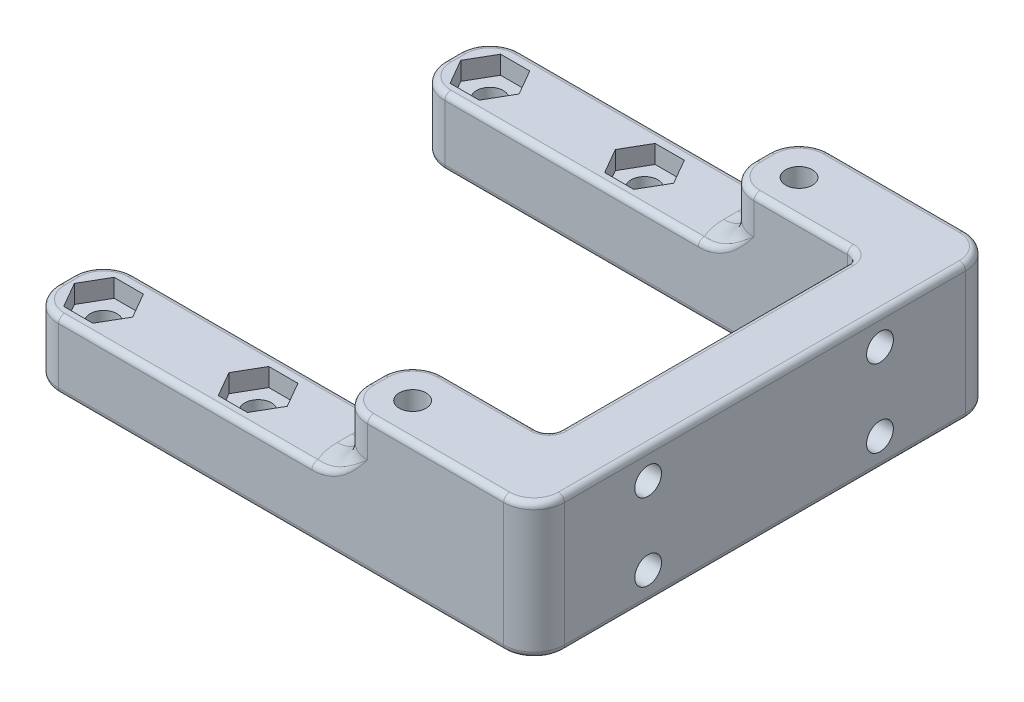
from build123d import *

# Parameters (mm, degrees)
SKETCH1_R           = 2.2
BOSS_EXTRUDE1_DEPTH = 22.2504
SKETCH2_W           = 50.8
SKETCH2_H           = 11.1252
CUT_EXTRUDE1_DEPTH  = 115.756630236
CUT_EXTRUDE2_DEPTH  = 3
FILLET3_R           = 5
CUT_EXTRUDE3_REACH  = 108.964
SKETCH4_R           = 2.2
FILLET4_R           = 5
FILLET5_R           = 5
FILLET6_R           = 2
FILLET7_R           = 1


with BuildPart() as part:
    # Sketch1 → Boss-Extrude1 (new body)
    with BuildSketch(Plane(origin=(0, 0, 0), x_dir=(1, 0, 0), z_dir=(0, 1, 0))):
        Polygon((0, 0), (73.15, 0), (73.15, -51.1048), (0, -51.1048), (0, -63.5), (83.15, -63.5), (83.15, 12.3952), (0, 12.3952), align=None)
        with Locations(Location((6.35, 6.0452, 0), (0, 0, 90))):
            Circle(SKETCH1_R, mode=Mode.SUBTRACT)
        with Locations(Location((57.15, 6.0452, 0), (0, 0, 90))):
            Circle(SKETCH1_R, mode=Mode.SUBTRACT)
        with Locations(Location((6.35, -57.4548, 0), (0, 0, 90))):
            Circle(SKETCH1_R, mode=Mode.SUBTRACT)
        with Locations(Location((57.15, -57.4548, 0), (0, 0, 90))):
            Circle(SKETCH1_R, mode=Mode.SUBTRACT)
        with Locations(Location((31.75, 6.0452, 0), (0, 0, 90))):
            Circle(SKETCH1_R, mode=Mode.SUBTRACT)
        with Locations(Location((31.75, -57.4548, 0), (0, 0, 90))):
            Circle(SKETCH1_R, mode=Mode.SUBTRACT)
    extrude(amount=BOSS_EXTRUDE1_DEPTH)

    # Sketch2 → Cut-Extrude1 (cut, through all)
    with BuildSketch(Plane.XY.offset(63.5)):
        with Locations((25.4, 16.6878)):
            Rectangle(SKETCH2_W, SKETCH2_H)
    extrude(amount=-CUT_EXTRUDE1_DEPTH, mode=Mode.SUBTRACT)

    # Sketch3 → Cut-Extrude2 (cut)
    with BuildSketch(Plane(origin=(0, 11.1252, 0), x_dir=(1, 0, 0), z_dir=(0, 1, 0))):
        Polygon((36.542007234, 6.0452), (34.146003617, 10.1952), (29.353996383, 10.1952), (26.957992766, 6.0452), (29.353996383, 1.8952), (34.146003617, 1.8952), align=None)
        Polygon((11.142007234, 6.0452), (8.746003617, 10.1952), (3.953996383, 10.1952), (1.557992766, 6.0452), (3.953996383, 1.8952), (8.746003617, 1.8952), align=None)
        Polygon((36.542007234, -57.4548), (34.146003617, -53.3048), (29.353996383, -53.3048), (26.957992766, -57.4548), (29.353996383, -61.6048), (34.146003617, -61.6048), align=None)
        Polygon((11.142007234, -57.4548), (8.746003617, -53.3048), (3.953996383, -53.3048), (1.557992766, -57.4548), (3.953996383, -61.6048), (8.746003617, -61.6048), align=None)
    extrude(amount=-CUT_EXTRUDE2_DEPTH, mode=Mode.SUBTRACT)

    # Fillet3
    fillet3_edges = [part.edges().sort_by_distance(p)[0] for p in [
        (0, 5.5626, -12.3952),
        (0, 5.5626, 63.5),
        (0, 5.5626, 51.1048),
        (0, 5.5626, 0),
    ]]
    fillet(fillet3_edges, radius=FILLET3_R)

    # Sketch4 → Cut-Extrude3 (cut, up to next)
    with BuildSketch(Plane(origin=(83.15, 0, 0), x_dir=(0, 0, -1), z_dir=(1, 0, 0)), mode=Mode.PRIVATE) as cut_extrude3_sk1:
        with Locations((-44.7548, 17.4752)):
            Circle(SKETCH4_R)
    cut_extrude3_tool1 = extrude(cut_extrude3_sk1.sketch, amount=-CUT_EXTRUDE3_REACH, mode=Mode.PRIVATE) & part.part
    # Sketch4 → Cut-Extrude3 (cut, up to next)
    with BuildSketch(Plane(origin=(83.15, 0, 0), x_dir=(0, 0, -1), z_dir=(1, 0, 0)), mode=Mode.PRIVATE) as cut_extrude3_sk2:
        with Locations((-44.7548, 4.7752)):
            Circle(SKETCH4_R)
    cut_extrude3_tool2 = extrude(cut_extrude3_sk2.sketch, amount=-CUT_EXTRUDE3_REACH, mode=Mode.PRIVATE) & part.part
    # Sketch4 → Cut-Extrude3 (cut, up to next)
    with BuildSketch(Plane(origin=(83.15, 0, 0), x_dir=(0, 0, -1), z_dir=(1, 0, 0)), mode=Mode.PRIVATE) as cut_extrude3_sk3:
        with Locations((-6.6548, 4.7752)):
            Circle(SKETCH4_R)
    cut_extrude3_tool3 = extrude(cut_extrude3_sk3.sketch, amount=-CUT_EXTRUDE3_REACH, mode=Mode.PRIVATE) & part.part
    # Sketch4 → Cut-Extrude3 (cut, up to next)
    with BuildSketch(Plane(origin=(83.15, 0, 0), x_dir=(0, 0, -1), z_dir=(1, 0, 0)), mode=Mode.PRIVATE) as cut_extrude3_sk4:
        with Locations((-6.6548, 17.4752)):
            Circle(SKETCH4_R)
    cut_extrude3_tool4 = extrude(cut_extrude3_sk4.sketch, amount=-CUT_EXTRUDE3_REACH, mode=Mode.PRIVATE) & part.part
    add(cut_extrude3_tool1.solids().sort_by_distance((83.15, 17.4752, 44.7548))[0], mode=Mode.SUBTRACT)
    add(cut_extrude3_tool2.solids().sort_by_distance((83.15, 4.7752, 44.7548))[0], mode=Mode.SUBTRACT)
    add(cut_extrude3_tool3.solids().sort_by_distance((83.15, 4.7752, 6.6548))[0], mode=Mode.SUBTRACT)
    add(cut_extrude3_tool4.solids().sort_by_distance((83.15, 17.4752, 6.6548))[0], mode=Mode.SUBTRACT)

    # Fillet4
    fillet4_edges = [part.edges().sort_by_distance(p)[0] for p in [
        (83.15, 11.1252, -12.3952),
        (83.15, 11.1252, 63.5),
        (50.8, 16.6878, 63.5),
        (50.8, 16.6878, 0),
        (50.8, 16.6878, 51.1048),
        (50.8, 16.6878, -12.3952),
    ]]
    fillet(fillet4_edges, radius=FILLET4_R)

    # Fillet5
    # the kernel refuses this fillet: 5 mm, written as the material it adds along each edge
    with BuildSketch(Plane(origin=(50.8, 11.1252, 58.5), x_dir=(0, 1, 0), z_dir=(0, 0, -1)), Plane(origin=(50.8, 11.1252, -5), x_dir=(0, 1, 0), z_dir=(0, 0, -1))) as fillet5_piece_1:
        with BuildLine():
            CenterArc((FILLET5_R, -FILLET5_R), FILLET5_R, 90, 90)
            Line((0, -FILLET5_R), (0, 0))
            Line((0, 0), (FILLET5_R, 0))
        make_face()
    extrude(amount=2.3952)
    with BuildSketch(Plane(origin=(55.8, 11.1252, 56.1048), x_dir=(0.5976672776328276, 0, 0.8017442392976483), z_dir=(-0.8017442392976483, 0, 0.5976672776328276))) as fillet5_piece_2_section:
        with BuildLine():
            CenterArc((5 + FILLET5_R, FILLET5_R), FILLET5_R, 180, 90)
            Line((5 + FILLET5_R, 0), (5, 0))
            Line((5, 0), (5, FILLET5_R))
        make_face()
    fillet5_piece_2 = revolve(axis=Axis((55.8, 11.1252, 56.1048), (0, 1, 0)), revolution_arc=233.296989237, mode=Mode.PRIVATE)
    fillet5_piece_2 = split(fillet5_piece_2, bisect_by=Plane(origin=(52.050305289, 12.68334163, 63.5), z_dir=(0, 0, -1)), keep=Keep.TOP, mode=Mode.PRIVATE)
    fillet5_piece_2 = split(fillet5_piece_2, bisect_by=Plane(origin=(52.050305289, 12.68334163, 51.1048), z_dir=(0, 0, 1)), keep=Keep.TOP, mode=Mode.PRIVATE)
    add(fillet5_piece_2)
    with BuildSketch(Plane(origin=(55.8, 11.1252, 58.5), x_dir=(0.5976672776328285, 0, -0.8017442392976476), z_dir=(-0.8017442392976476, 0, -0.5976672776328285))) as fillet5_piece_3_section:
        with BuildLine():
            CenterArc((5 + FILLET5_R, -FILLET5_R), FILLET5_R, 90, 90)
            Line((5 + FILLET5_R, 0), (5, 0))
            Line((5, 0), (5, -FILLET5_R))
        make_face()
    fillet5_piece_3 = revolve(axis=Axis((55.8, 11.1252, 58.5), (0, -1, 0)), revolution_arc=233.296989237, mode=Mode.PRIVATE)
    fillet5_piece_3 = split(fillet5_piece_3, bisect_by=Plane(origin=(52.050305376, 12.683341613, 63.5), z_dir=(0, 0, -1)), keep=Keep.TOP, mode=Mode.PRIVATE)
    fillet5_piece_3 = split(fillet5_piece_3, bisect_by=Plane(origin=(52.050305376, 12.683341613, 51.1048), z_dir=(0, 0, 1)), keep=Keep.TOP, mode=Mode.PRIVATE)
    add(fillet5_piece_3)
    with BuildSketch(Plane(origin=(55.8, 11.1252, -7.3952), x_dir=(-1, 0, 0), z_dir=(0, 0, 1))) as fillet5_piece_4_section:
        with BuildLine():
            CenterArc((5 + FILLET5_R, -FILLET5_R), FILLET5_R, 90, 90)
            Line((5 + FILLET5_R, 0), (5, 0))
            Line((5, 0), (5, -FILLET5_R))
        make_face()
    fillet5_piece_4 = revolve(axis=Axis((55.8, 11.1252, -7.3952), (0, -1, 0)), revolution_arc=233.296989237, mode=Mode.PRIVATE)
    fillet5_piece_4 = split(fillet5_piece_4, bisect_by=Plane(origin=(52.050305237, 12.683341421, 0), z_dir=(0, 0, -1)), keep=Keep.TOP, mode=Mode.PRIVATE)
    fillet5_piece_4 = split(fillet5_piece_4, bisect_by=Plane(origin=(52.050305237, 12.683341421, -12.3952), z_dir=(0, 0, 1)), keep=Keep.TOP, mode=Mode.PRIVATE)
    add(fillet5_piece_4)
    with BuildSketch(Plane(origin=(55.8, 11.1252, -5), x_dir=(0.5976672776328275, 0, -0.8017442392976483), z_dir=(-0.8017442392976483, 0, -0.5976672776328275))) as fillet5_piece_5_section:
        with BuildLine():
            CenterArc((5 + FILLET5_R, -FILLET5_R), FILLET5_R, 90, 90)
            Line((5 + FILLET5_R, 0), (5, 0))
            Line((5, 0), (5, -FILLET5_R))
        make_face()
    fillet5_piece_5 = revolve(axis=Axis((55.8, 11.1252, -5), (0, -1, 0)), revolution_arc=233.296989237, mode=Mode.PRIVATE)
    fillet5_piece_5 = split(fillet5_piece_5, bisect_by=Plane(origin=(52.05030535, 12.683341842, 0), z_dir=(0, 0, -1)), keep=Keep.TOP, mode=Mode.PRIVATE)
    fillet5_piece_5 = split(fillet5_piece_5, bisect_by=Plane(origin=(52.05030535, 12.683341842, -12.3952), z_dir=(0, 0, 1)), keep=Keep.TOP, mode=Mode.PRIVATE)
    add(fillet5_piece_5)

    # Fillet6
    fillet6_edges = [part.edges().sort_by_distance(p)[0] for p in [
        (73.15, 11.1252, 51.1048),
        (73.15, 11.1252, 0),
    ]]
    fillet(fillet6_edges, radius=FILLET6_R)

    # Fillet7
    fillet7_edges = [part.edges().sort_by_distance(p)[0] for p in [
        (0, 11.1252, -6.1976),
        (0, 0, -6.1976),
        (41.575, 0, 63.5),
        (0, 0, 57.3024),
        (38.075, 0, 0),
        (1.464466094, 0, 62.035533906),
        (1.464466094, 0, 52.569266094),
        (1.464466094, 0, -1.464466094),
        (1.464466094, 0, -10.930733906),
        (26.069872981, 11.1252, -12.3952),
        (1.464466094, 11.1252, -1.464466094),
        (1.464466094, 11.1252, -10.930733906),
        (0, 11.1252, 57.3024),
        (26.069872981, 11.1252, 51.1048),
        (26.069872981, 11.1252, 63.5),
        (1.464466094, 11.1252, 62.035533906),
        (1.464466094, 11.1252, 52.569266094),
        (41.575, 0, -12.3952),
        (66.975, 22.2504, -12.3952),
        (83.15, 0, 25.5524),
        (81.685533906, 0, 62.035533906),
        (81.685533906, 0, -10.930733906),
        (83.15, 22.2504, 25.5524),
        (50.8, 22.2504, -6.1976),
        (63.475, 22.2504, 0),
        (50.8, 22.2504, 57.3024),
        (66.975, 22.2504, 63.5),
        (52.264466094, 22.2504, -1.464466094),
        (52.264466094, 22.2504, -10.930733906),
        (52.264466094, 22.2504, 62.035533906),
        (52.264466094, 22.2504, 52.569266094),
        (81.685533906, 22.2504, 62.035533906),
        (81.685533906, 22.2504, -10.930733906),
        (26.069872981, 11.1252, 0),
        (51.940144071, 12.744074195, 51.1048),
        (51.940144032, 12.744074168, 63.5),
        (51.940144071, 12.744074195, -12.3952),
        (51.940144071, 12.744074195, 0),
        (63.475, 22.2504, 51.1048),
        (38.075, 0, 51.1048),
        (73.15, 0, 25.5524),
        (73.15, 22.2504, 25.5524),
        (72.564213562, 0, 50.519013562),
        (72.564213562, 22.2504, 50.519013562),
        (72.564213562, 0, 0.585786438),
        (72.564213562, 22.2504, 0.585786438),
    ]]
    fillet(fillet7_edges, radius=FILLET7_R)


solid = part.part
